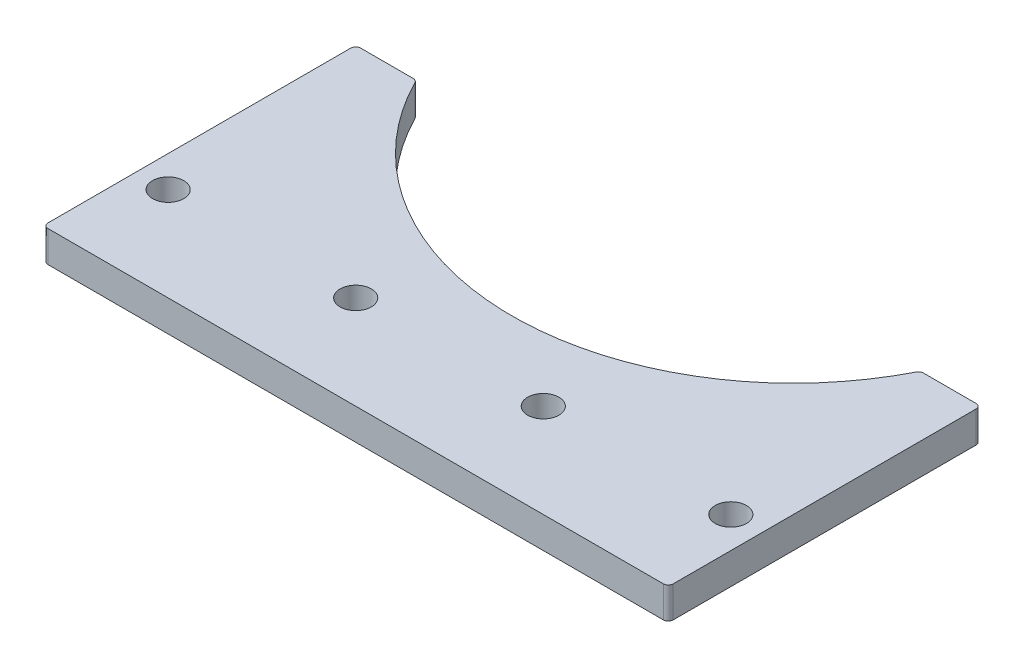
from build123d import *

# Parameters (mm, degrees)
BOSS_EXTRUDE1_DEPTH = 6.35
SKETCH2_R           = 3.175
CUT_EXTRUDE1_DEPTH  = 110.433918417
FILLET1_R           = 1


with BuildPart() as part:
    # Sketch1 → Boss-Extrude1 (new body)
    with BuildSketch(Plane(origin=(0, 0, 0), x_dir=(1, 0, 0), z_dir=(0, 1, 0))):
        with BuildLine():
            Line((51.195336702, -25.4), (63.5, -25.4))
            Line((63.5, -25.4), (63.5, -88.9))
            Line((63.5, -88.9), (-63.5, -88.9))
            Line((-63.5, -88.9), (-63.5, -25.4))
            Line((-63.5, -25.4), (-51.195336702, -25.4))
            ThreePointArc((-51.195336702, -25.4), (0, -57.15), (51.195336702, -25.4))
        make_face()
    extrude(amount=BOSS_EXTRUDE1_DEPTH)

    # Sketch2 → Cut-Extrude1 (cut, through all)
    with BuildSketch(Plane(origin=(0, 6.35, 0), x_dir=(-1, 0, 0), z_dir=(0, 1, 0))):
        with Locations((19.05, 69.85)):
            Circle(SKETCH2_R)
        with Locations((-19.05, 69.85)):
            Circle(SKETCH2_R)
        with Locations((-57.15, 69.85)):
            Circle(SKETCH2_R)
        with Locations((57.15, 69.85)):
            Circle(SKETCH2_R)
    extrude(amount=-CUT_EXTRUDE1_DEPTH, mode=Mode.SUBTRACT)

    # Fillet1
    fillet1_edges = [part.edges().sort_by_distance(p)[0] for p in [
        (-51.195336702, 3.175, 25.4),
        (-63.5, 3.175, 25.4),
        (-63.5, 3.175, 88.9),
        (63.5, 3.175, 88.9),
        (51.195336702, 3.175, 25.4),
        (63.5, 3.175, 25.4),
    ]]
    fillet(fillet1_edges, radius=FILLET1_R)


solid = part.part
